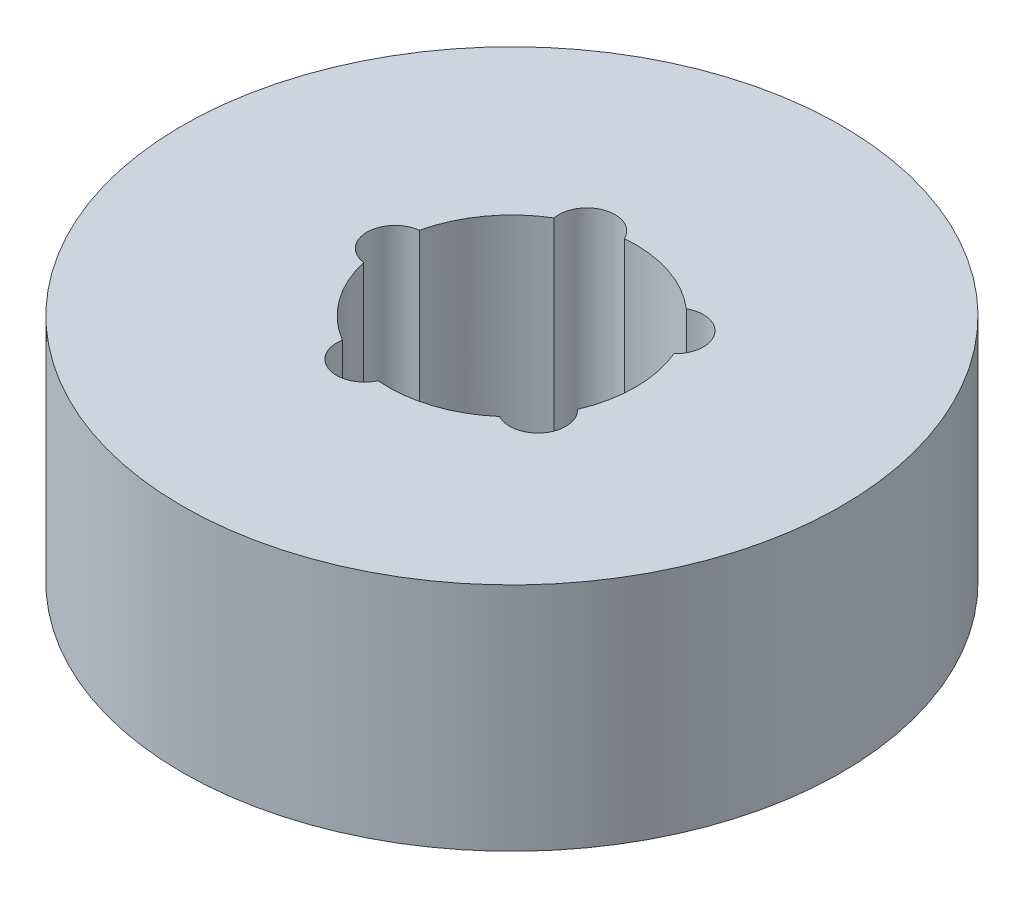
from build123d import *

# Parameters (mm, degrees)
SKETCH1_R           = 40
BOSS_EXTRUDE1_DEPTH = 28
SKETCH2_R           = 15
CUT_EXTRUDE1_DEPTH  = 64.118935352
SKETCH3_R           = 3.410825195
CUT_EXTRUDE2_DEPTH  = 23.899809634
CIRPATTERN1_COUNT   = 5


with BuildPart() as part:
    # Sketch1 → Boss-Extrude1 (new body)
    with BuildSketch(Plane(origin=(0, 0, 0), x_dir=(1, 0, 0), z_dir=(0, 1, 0))):
        Circle(SKETCH1_R)
    extrude(amount=BOSS_EXTRUDE1_DEPTH)

    # Sketch2 → Cut-Extrude1 (cut, through all)
    with BuildSketch(Plane(origin=(0, 0, 0), x_dir=(1, 0, 0), z_dir=(0, 1, 0))):
        Circle(SKETCH2_R)
    extrude(amount=CUT_EXTRUDE1_DEPTH, mode=Mode.SUBTRACT)

    # Sketch3 → Cut-Extrude2 (cut)
    with BuildSketch(Plane(origin=(0, 28, 0), x_dir=(1, 0, 0), z_dir=(0, 1, 0))):
        with Locations((-14.190448984, 0)):
            Circle(SKETCH3_R)
    cut_extrude2 = extrude(amount=-CUT_EXTRUDE2_DEPTH, mode=Mode.SUBTRACT)

    # CirPattern1: Cut-Extrude2 ×5 about axis
    cirpattern1_axis = Axis((0, 0, 0), (0, 1, 0))
    for i in range(1, CIRPATTERN1_COUNT):
        add(cut_extrude2.rotate(cirpattern1_axis, i * 360 / CIRPATTERN1_COUNT), mode=Mode.SUBTRACT)


solid = part.part
